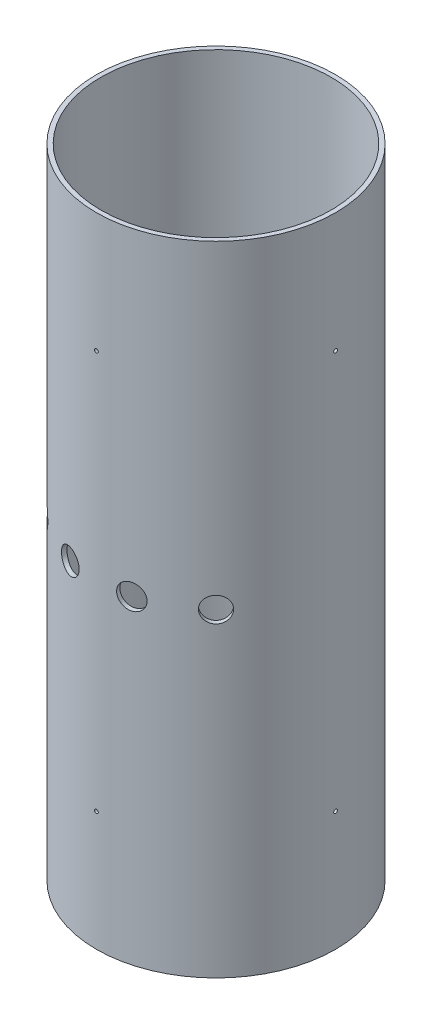
from build123d import *

# Parameters (mm, degrees)
COUPLER_PROFILE_R      = 76.1746
COUPLER_PROFILE_R_2    = 73.3425
COUPLER_BODY_DEPTH     = 406.4
SKETCH1_R              = 1.190625
CUT_EXTRUDE1_DEPTH     = 421.435606687
CIRPATTERN1_COUNT      = 4
SKETCH3_R              = 7.9375
KEY_HOLE_CUTS_DEPTH    = 421.43560682
KEY_HOLE_PATTERN_COUNT = 4
KEY_HOLE_PATTERN_ANGLE = 90
SKETCH4_R              = 3.175
CUT_EXTRUDE2_DEPTH     = 421.43560682


with BuildPart() as part:
    # Coupler Profile → Coupler Body (new body)
    with BuildSketch(Plane(origin=(0, 0, 0), x_dir=(1, 0, 0), z_dir=(0, 1, 0))):
        Circle(COUPLER_PROFILE_R)
        Circle(COUPLER_PROFILE_R_2, mode=Mode.SUBTRACT)
    extrude(amount=COUPLER_BODY_DEPTH)

    # Sketch1 → Cut-Extrude1 (cut, symmetric)
    with BuildSketch(Plane.XY):
        with Locations((0, 76.2)):
            Circle(SKETCH1_R)
        with Locations((0, 330.2)):
            Circle(SKETCH1_R)
    cut_extrude1 = extrude(amount=CUT_EXTRUDE1_DEPTH, both=True, mode=Mode.SUBTRACT)

    # CirPattern1: Cut-Extrude1 ×4 about axis
    cirpattern1_axis = Axis((0, 0, 0), (0, 1, 0))
    for i in range(1, CIRPATTERN1_COUNT):
        add(cut_extrude1.rotate(cirpattern1_axis, i * 360 / CIRPATTERN1_COUNT), mode=Mode.SUBTRACT)

    # Sketch3 → Key Hole Cuts (cut, through all)
    with BuildSketch(Plane(origin=(0, 0, 0), x_dir=(0, 1, 0), z_dir=(0.7071067811865488, 0, 0.7071067811865464))):
        with Locations((203.2, 0)):
            Circle(SKETCH3_R)
    key_hole_cuts = extrude(amount=KEY_HOLE_CUTS_DEPTH, mode=Mode.SUBTRACT)

    # Key Hole Pattern: Key Hole Cuts ×4 about axis
    key_hole_pattern_axis = Axis((0, 406.4, 0), (0, -1, 0))
    for i in range(1, KEY_HOLE_PATTERN_COUNT):
        add(key_hole_cuts.rotate(key_hole_pattern_axis, i * KEY_HOLE_PATTERN_ANGLE / (KEY_HOLE_PATTERN_COUNT - 1)), mode=Mode.SUBTRACT)

    # Sketch4 → Cut-Extrude2 (cut, through all)
    with BuildSketch(Plane.XY):
        with Locations((0, 203.2)):
            Circle(SKETCH4_R)
    extrude(amount=-CUT_EXTRUDE2_DEPTH, mode=Mode.SUBTRACT)


solid = part.part
